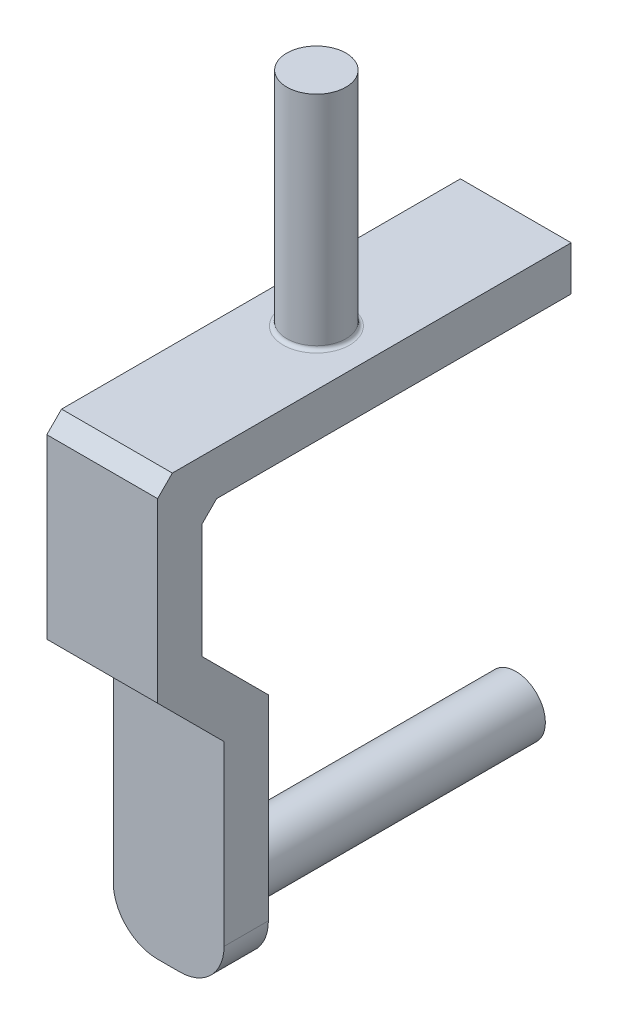
from build123d import *

# Parameters (mm, degrees)
CROQUIS1_W     = 15
CROQUIS1_H     = 65
EXTRUIR1_DEPTH = 6
CROQUIS2_W     = 15
CROQUIS2_H     = 6
EXTRUIR2_DEPTH = 50
CHAFL_N1_SIZE  = 2
CROQUIS3_R     = 4
EXTRUIR3_DEPTH = 50
CHAFL_N2_SIZE  = 3
REDONDEO1_R    = 6
CROQUIS4_R     = 4
EXTRUIR4_DEPTH = 30
REDONDEO2_R    = 0.5
EXTRUIR5_DEPTH = 15
CHAFL_N3_SIZE  = 9
EXTRUIR6_DEPTH = 15
CHAFL_N4_SIZE  = 3


with BuildPart() as part:
    # Croquis1 → Extruir1 (new body)
    with BuildSketch(Plane.XY):
        Rectangle(CROQUIS1_W, CROQUIS1_H)
    extrude(amount=EXTRUIR1_DEPTH)

    # Croquis2 → Extruir2 (add)
    with BuildSketch(Plane(origin=(0, 0, 0), x_dir=(-1, 0, 0), z_dir=(0, 0, -1))):
        with Locations((0, 29.5)):
            Rectangle(CROQUIS2_W, CROQUIS2_H)
    extrude(amount=EXTRUIR2_DEPTH)

    # Chaflán1
    chafl_n1_edges = [part.edges().sort_by_distance(p)[0] for p in [
        (0, 32.5, 6),
        (0, 26.5, 0),
    ]]
    chamfer(chafl_n1_edges, length=CHAFL_N1_SIZE)

    # Croquis3 → Extruir3 (add)
    with BuildSketch(Plane(origin=(0, 0, 0), x_dir=(-1, 0, 0), z_dir=(0, 0, -1))):
        with Locations(Location((0, -25.5, 0), (0, 0, 180))):
            Circle(CROQUIS3_R)
    extrude(amount=EXTRUIR3_DEPTH)

    # Chaflán2
    chafl_n2_edges = [part.edges().sort_by_distance(p)[0] for p in [
        (-4, -25.5, 0),
    ]]
    chamfer(chafl_n2_edges, length=CHAFL_N2_SIZE - 0.0001)  # a hair under: the kernel refuses the full size

    # Redondeo1
    redondeo1_edges = [part.edges().sort_by_distance(p)[0] for p in [
        (-7.5, -32.5, 3),
        (7.5, -32.5, 3),
    ]]
    fillet(redondeo1_edges, radius=REDONDEO1_R)

    # Croquis4 → Extruir4 (add)
    with BuildSketch(Plane(origin=(0, 32.5, 0), x_dir=(1, 0, 0), z_dir=(0, 1, 0))):
        with Locations(Location((0, 23, 0), (0, 0, 90))):
            Circle(CROQUIS4_R)
    extrude(amount=EXTRUIR4_DEPTH)

    # Redondeo2
    redondeo2_edges = [part.edges().sort_by_distance(p)[0] for p in [
        (0, 32.5, -19),
    ]]
    fillet(redondeo2_edges, radius=REDONDEO2_R)

    # Croquis6 → Extruir5 (add)
    with BuildSketch(Plane.XY.offset(6)):
        with BuildLine():
            Line((7.5, 0), (-7.5, 0))
            Line((-7.5, 0), (-7.5, -26.5))
            ThreePointArc((-7.5, -26.5), (-5.742640687, -30.742640687), (-1.5, -32.5))
            Line((-1.5, -32.5), (1.5, -32.5))
            ThreePointArc((1.5, -32.5), (5.742640687, -30.742640687), (7.5, -26.5))
            Line((7.5, -26.5), (7.5, 0))
        make_face()
    extrude(amount=-EXTRUIR5_DEPTH)

    # Chaflán3
    chafl_n3_edges = [part.edges().sort_by_distance(p)[0] for p in [
        (0, 0, 0),
    ]]
    chamfer(chafl_n3_edges, length=CHAFL_N3_SIZE - 0.0001)  # a hair under: the kernel refuses the full size

    # Croquis7 → Extruir6 (cut)
    with BuildSketch(Plane(origin=(7.5, 0, 0), x_dir=(0, 0, -1), z_dir=(1, 0, 0))):
        Polygon((-6, 6.514718626), (3, -2.485281374), (3, -32.5), (-11.901527466, -39.580751492), align=None)
    extrude(amount=-EXTRUIR6_DEPTH, mode=Mode.SUBTRACT)

    # Chaflán4
    chafl_n4_edges = [part.edges().sort_by_distance(p)[0] for p in [
        (-4, -25.5, -9),
    ]]
    chamfer(chafl_n4_edges, length=CHAFL_N4_SIZE - 0.0001)  # a hair under: the kernel refuses the full size


solid = part.part
